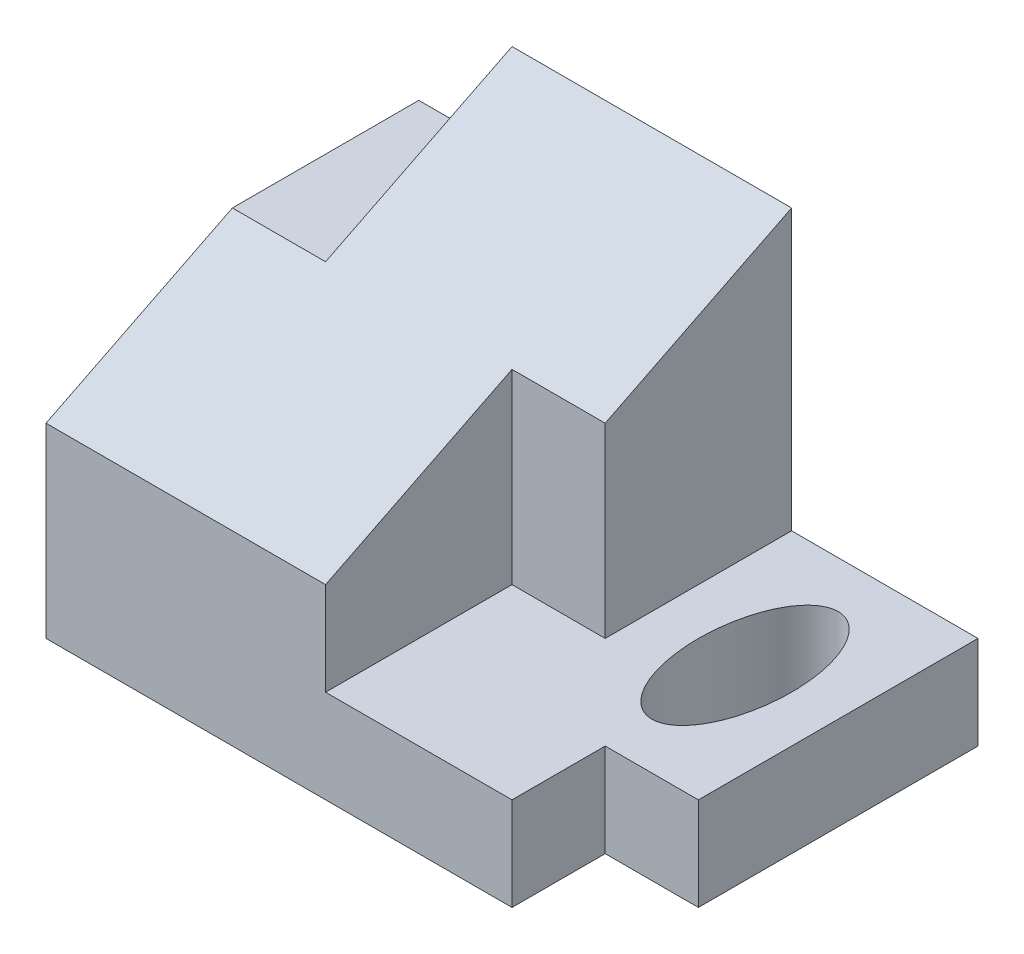
from build123d import *

# Parameters (mm, degrees)
SKETCH2_W           = 152.4
SKETCH2_H           = 101.6
BOSS_EXTRUDE1_DEPTH = 50.8
SKETCH3_W           = 50.8
SKETCH3_H           = 76.2
CUT_EXTRUDE1_DEPTH  = 137.783186101
SKETCH4_W           = 25.4
SKETCH4_H           = 25.4
CUT_EXTRUDE2_DEPTH  = 120.1365603
SKETCH5_W           = 25.4
SKETCH5_H           = 50.8
CUT_EXTRUDE3_DEPTH  = 76.2
SKETCH6_W           = 25.4
SKETCH6_H           = 25.4
CUT_EXTRUDE4_DEPTH  = 137.783186101
CHAMFER1_SIZE2      = 101.6
CHAMFER1_SIZE       = 50.8
SKETCH7_RX          = 25.4
SKETCH7_RY          = 12.7
CUT_EXTRUDE5_DEPTH  = 120.1365603


with BuildPart() as part:
    # Sketch2 → Boss-Extrude1 (new, symmetric)
    with BuildSketch(Plane.XY):
        Rectangle(SKETCH2_W, SKETCH2_H)
    extrude(amount=BOSS_EXTRUDE1_DEPTH, both=True)

    # Sketch3 → Cut-Extrude1 (cut, through all)
    with BuildSketch(Plane.XY.offset(50.8)):
        with Locations((50.8, 12.7)):
            Rectangle(SKETCH3_W, SKETCH3_H)
    extrude(amount=-CUT_EXTRUDE1_DEPTH, mode=Mode.SUBTRACT)

    # Sketch4 → Cut-Extrude2 (cut, through all)
    with BuildSketch(Plane(origin=(0, -25.4, 0), x_dir=(1, 0, 0), z_dir=(0, 1, 0))):
        with Locations((63.5, -38.1)):
            Rectangle(SKETCH4_W, SKETCH4_H)
    extrude(amount=-CUT_EXTRUDE2_DEPTH, mode=Mode.SUBTRACT)

    # Sketch5 → Cut-Extrude3 (cut)
    with BuildSketch(Plane(origin=(0, 50.8, 0), x_dir=(1, 0, 0), z_dir=(0, 1, 0))):
        with Locations((12.7, -25.4)):
            Rectangle(SKETCH5_W, SKETCH5_H)
    extrude(amount=-CUT_EXTRUDE3_DEPTH, mode=Mode.SUBTRACT)

    # Sketch6 → Cut-Extrude4 (cut, through all)
    with BuildSketch(Plane(origin=(0, 0, -50.8), x_dir=(-1, 0, 0), z_dir=(0, 0, -1))):
        with Locations((63.5, 38.1)):
            Rectangle(SKETCH6_W, SKETCH6_H)
    extrude(amount=-CUT_EXTRUDE4_DEPTH, mode=Mode.SUBTRACT)

    # Chamfer1
    chamfer1_edges = [part.edges().sort_by_distance(p)[0] for p in [
        (-25.4, 50.8, 50.8),
    ]]
    chamfer1_side = [part.faces().sort_by_distance(p)[0] for p in [
        (-25.4, 49.784, 50.8),
    ]]
    chamfer(chamfer1_edges, length=CHAMFER1_SIZE - 0.0001, length2=CHAMFER1_SIZE2 - 0.0001, reference=chamfer1_side[0])  # a hair under: the kernel refuses the full size

    # Sketch7 → Cut-Extrude5 (cut, through all)
    with BuildSketch(Plane(origin=(0, -25.4, 0), x_dir=(1, 0, 0), z_dir=(0, 1, 0))):
        with Locations(Location((50.8, 12.7), (0, 0, -90))):
            Ellipse(SKETCH7_RX, SKETCH7_RY)
    extrude(amount=-CUT_EXTRUDE5_DEPTH, mode=Mode.SUBTRACT)


solid = part.part
